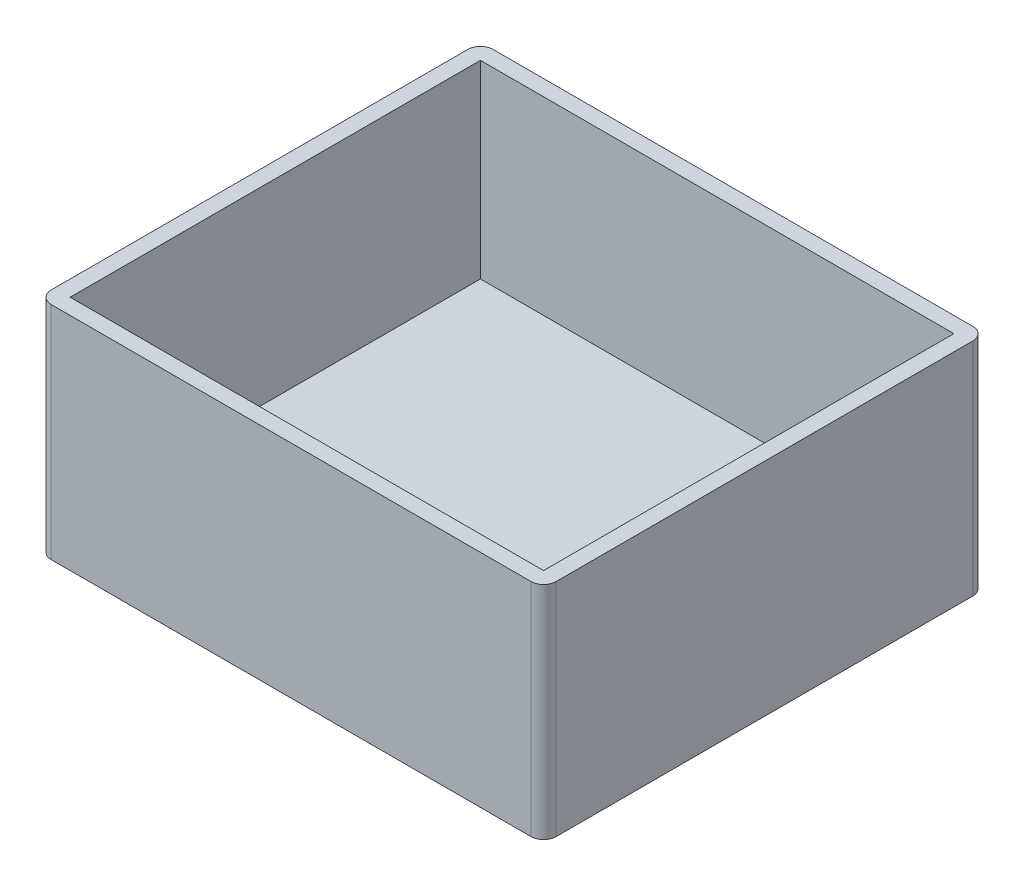
from build123d import *

# Parameters (mm, degrees)
SKETCH1_W           = 80
SKETCH1_H           = 70
BOSS_EXTRUDE1_DEPTH = 35
SKETCH3_W           = 75
SKETCH3_H           = 65
CUT_EXTRUDE1_DEPTH  = 30
FILLET2_R           = 2


with BuildPart() as part:
    # Sketch1 → Boss-Extrude1 (new body)
    with BuildSketch(Plane(origin=(0, 0, 0), x_dir=(1, 0, 0), z_dir=(0, 1, 0))):
        with Locations((-0.036215341, -22.978809591)):
            Rectangle(SKETCH1_W, SKETCH1_H)
    extrude(amount=BOSS_EXTRUDE1_DEPTH)

    # Sketch3 → Cut-Extrude1 (cut)
    with BuildSketch(Plane(origin=(0, 35, 0), x_dir=(1, 0, 0), z_dir=(0, 1, 0))):
        with Locations((-0.036215341, -22.978809591)):
            Rectangle(SKETCH3_W, SKETCH3_H)
    extrude(amount=-CUT_EXTRUDE1_DEPTH, mode=Mode.SUBTRACT)

    # Fillet2
    fillet2_edges = [part.edges().sort_by_distance(p)[0] for p in [
        (-40.036215341, 17.5, 57.978809591),
        (39.963784659, 17.5, 57.978809591),
        (39.963784659, 17.5, -12.021190409),
        (-40.036215341, 17.5, -12.021190409),
    ]]
    fillet(fillet2_edges, radius=FILLET2_R)


solid = part.part
